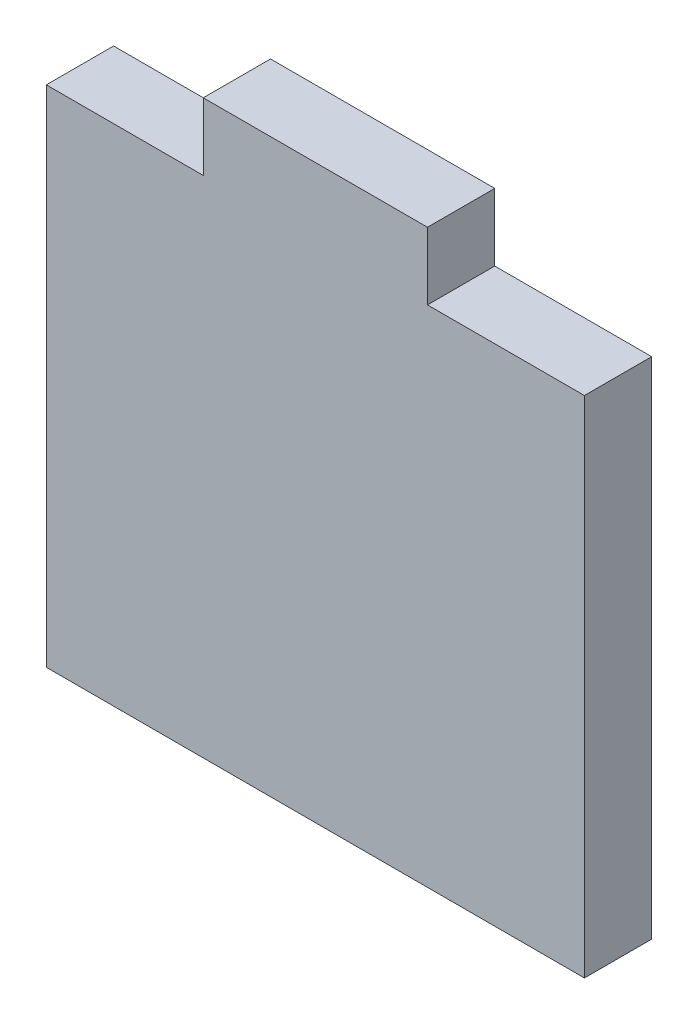
from build123d import *

# Parameters (mm, degrees)
ESQUISSE1_W        = 48
ESQUISSE1_H        = 45
BOSS_EXTRU_1_DEPTH = 6
ESQUISSE3_W        = 20
ESQUISSE3_H        = 6
BOSS_EXTRU_2_DEPTH = 6


with BuildPart() as part:
    # Esquisse1 → Boss.-Extru.1 (new body)
    with BuildSketch(Plane.XY):
        with Locations((-29.427833333, 12.816666667)):
            Rectangle(ESQUISSE1_W, ESQUISSE1_H)
    extrude(amount=BOSS_EXTRU_1_DEPTH)

    # Esquisse3 → Boss.-Extru.2 (add)
    with BuildSketch(Plane.XY.offset(6)):
        with Locations((-29.427833333, 38.316666667)):
            Rectangle(ESQUISSE3_W, ESQUISSE3_H)
    extrude(amount=-BOSS_EXTRU_2_DEPTH)


solid = part.part
